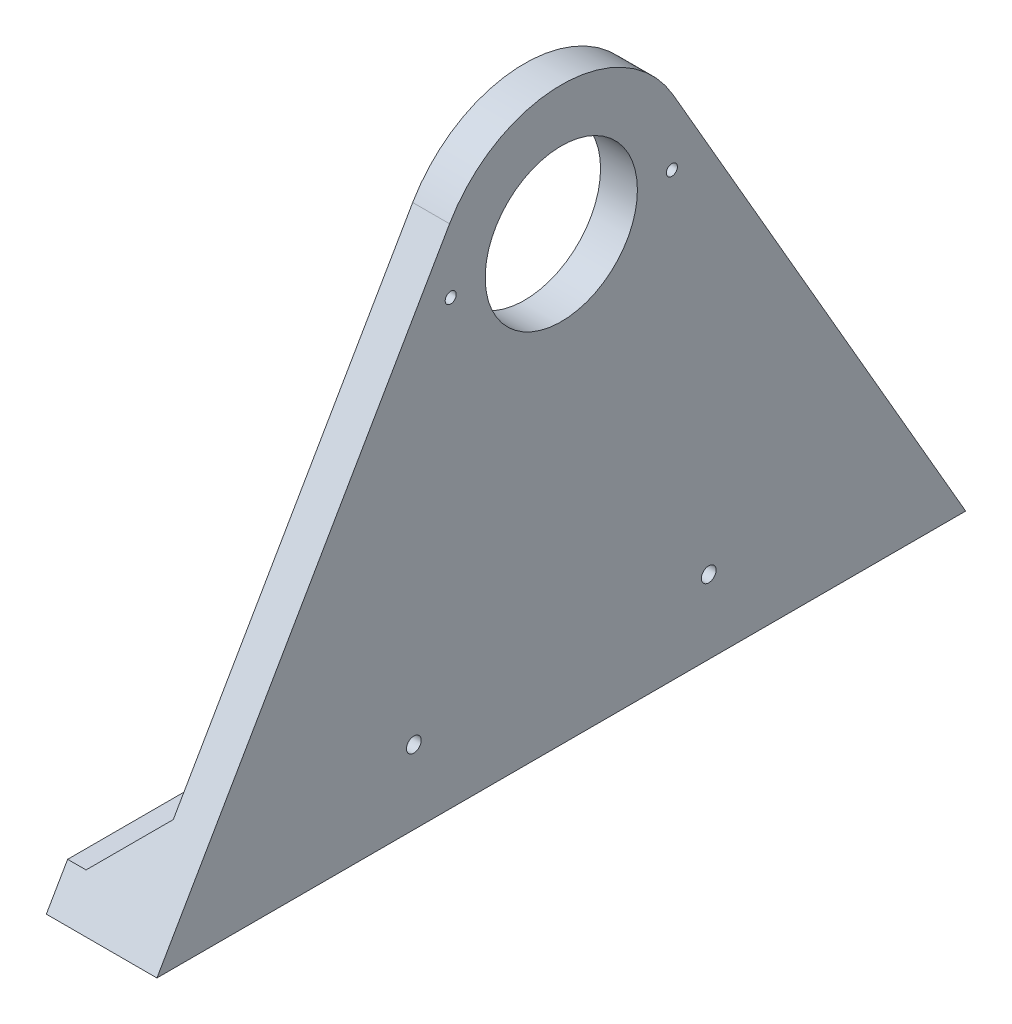
from build123d import *

# Parameters (mm, degrees)
CROQUIS1_R              = 20.65
CROQUIS1_R_2            = 1.5
SALIENTE_EXTRUIR1_DEPTH = 5
SALIENTE_EXTRUIR2_DEPTH = 20
CROQUIS3_R              = 1.5
CORTAR_EXTRUIR1_DEPTH   = 20
CROQUIS4_R              = 2
CORTAR_EXTRUIR2_DEPTH   = 166.327956902
CHAFL_N1_SIZE           = 15
CROQUIS5_R              = 7
CROQUIS5_R_2            = 2
CORTAR_EXTRUIR3_DEPTH   = 30
CORTAR_EXTRUIR4_START   = 30
CROQUIS6_R              = 6.5
CROQUIS6_R_2            = 1.5
CORTAR_EXTRUIR4_DEPTH   = 30


with BuildPart() as part:
    # Croquis1 → Saliente-Extruir1 (new, symmetric)
    with BuildSketch(Plane(origin=(0, 0, 0), x_dir=(0, 0, -1), z_dir=(1, 0, 0))):
        with BuildLine():
            Line((-109.696551146, -120), (109.696551146, -120))
            Line((109.696551146, -120), (30.310889132, 17.5))
            ThreePointArc((30.310889132, 17.5), (0, 35), (-30.310889132, 17.5))
            Line((-30.310889132, 17.5), (-109.696551146, -120))
        make_face()
        Circle(CROQUIS1_R, mode=Mode.SUBTRACT)
        with Locations((-30, 0)):
            Circle(CROQUIS1_R_2, mode=Mode.SUBTRACT)
        with Locations((30, 0)):
            Circle(CROQUIS1_R_2, mode=Mode.SUBTRACT)
    extrude(amount=SALIENTE_EXTRUIR1_DEPTH, both=True)

    # Croquis2 → Saliente-Extruir2 (add)
    with BuildSketch(Plane.ZY.offset(5)):
        Polygon((-109.696551146, -120), (-103.923048454, -110), (103.923048454, -110), (109.696551146, -120), align=None)
    extrude(amount=SALIENTE_EXTRUIR2_DEPTH)

    # Croquis3 → Cortar-Extruir1 (cut)
    with BuildSketch(Plane(origin=(0, -110, 0), x_dir=(1, 0, 0), z_dir=(0, 1, 0))):
        with Locations(Location((-15, 60, 0), (0, 0, 270))):
            Circle(CROQUIS3_R)
        with Locations(Location((-15, -60, 0), (0, 0, 270))):
            Circle(CROQUIS3_R)
        with Locations(Location((-15, 0, 0), (0, 0, 270))):
            Circle(CROQUIS3_R)
    extrude(amount=-CORTAR_EXTRUIR1_DEPTH, mode=Mode.SUBTRACT)

    # Croquis4 → Cortar-Extruir2 (cut, through all)
    with BuildSketch(Plane(origin=(5, 0, 0), x_dir=(0, 0, -1), z_dir=(1, 0, 0))):
        with Locations((-40, -100)):
            Circle(CROQUIS4_R)
        with Locations((40, -100)):
            Circle(CROQUIS4_R)
    extrude(amount=-CORTAR_EXTRUIR2_DEPTH, mode=Mode.SUBTRACT)

    # Chaflán1
    # the kernel refuses this chamfer: 15 mm, written as the material it adds along each edge
    with BuildSketch(Plane(origin=(-5, -110, -142.498293274), x_dir=(0.02749587661058636, 0.9996219169112966, 0), z_dir=(0, 0, 1))) as chafl_n1_piece_1_section:
        Polygon((CHAFL_N1_SIZE * 0.999621916911, CHAFL_N1_SIZE * 0.0274958766106), (-CHAFL_N1_SIZE * 0.0274958766106, CHAFL_N1_SIZE * 0.999621916911), (0, 0), align=None)
    chafl_n1_piece_1 = extrude(amount=284.996586547, mode=Mode.PRIVATE)
    chafl_n1_piece_1 = split(chafl_n1_piece_1, bisect_by=Plane(origin=(-9.982063802, -61.362690363, 75.842284643), z_dir=(0, -0.500000000000004, -0.8660254037844364)), keep=Keep.TOP, mode=Mode.PRIVATE)
    chafl_n1_piece_1 = split(chafl_n1_piece_1, bisect_by=Plane(origin=(-9.982063802, -61.362690271, -75.84228459), z_dir=(0, -0.4999999999999981, 0.8660254037844397)), keep=Keep.TOP, mode=Mode.PRIVATE)
    chafl_n1_piece_1 = chafl_n1_piece_1 - Plane(origin=(-9.982063802, -100, 40), x_dir=(0, 0, -1), z_dir=(1, 0, 0)) * Cylinder(2, 630, mode=Mode.PRIVATE)
    chafl_n1_piece_1 = chafl_n1_piece_1 - Plane(origin=(-9.982063802, -100, -40), x_dir=(0, 0, -1), z_dir=(1, 0, 0)) * Cylinder(2, 630, mode=Mode.PRIVATE)
    chafl_n1_piece_1 = chafl_n1_piece_1 - Plane(origin=(-15, -105.150253756, -60), x_dir=(0, 0, 1), z_dir=(0, 1, 0)) * Cylinder(1.5, 630, mode=Mode.PRIVATE)
    chafl_n1_piece_1 = chafl_n1_piece_1 - Plane(origin=(-15, -105.150253756, 0), x_dir=(0, 0, 1), z_dir=(0, 1, 0)) * Cylinder(1.5, 630, mode=Mode.PRIVATE)
    chafl_n1_piece_1 = chafl_n1_piece_1 - Plane(origin=(-15, -105.150253756, 60), x_dir=(0, 0, 1), z_dir=(0, 1, 0)) * Cylinder(1.5, 630, mode=Mode.PRIVATE)
    add(chafl_n1_piece_1)

    # Croquis5 → Cortar-Extruir3 (cut)
    # profile 1 of 2: a face of its own
    with BuildSketch(Plane.ZY.offset(5)):
        with Locations((-40, -100)):
            Circle(CROQUIS5_R)
        with Locations(Location((-40, -100, 0), (0, 0, 180))):
            Circle(CROQUIS5_R_2, mode=Mode.SUBTRACT)
    # profile 2 of 2: a face of its own
    with BuildSketch(Plane.ZY.offset(5)):
        with Locations((40, -100)):
            Circle(CROQUIS5_R)
        with Locations(Location((40, -100, 0), (0, 0, 180))):
            Circle(CROQUIS5_R_2, mode=Mode.SUBTRACT)
    extrude(amount=CORTAR_EXTRUIR3_DEPTH, mode=Mode.SUBTRACT)

    # Croquis6 → Cortar-Extruir4 (cut)
    # profile 1 of 3: a face of its own
    with BuildSketch(Plane(origin=(0, -110, 0), x_dir=(1, 0, 0), z_dir=(0, 1, 0)).offset(CORTAR_EXTRUIR4_START)):
        with Locations((-15, 60)):
            Circle(CROQUIS6_R)
        with Locations(Location((-15, 60, 0), (0, 0, 270))):
            Circle(CROQUIS6_R_2, mode=Mode.SUBTRACT)
    # profile 2 of 3: a face of its own
    with BuildSketch(Plane(origin=(0, -110, 0), x_dir=(1, 0, 0), z_dir=(0, 1, 0)).offset(CORTAR_EXTRUIR4_START)):
        with Locations((-15, 0)):
            Circle(CROQUIS6_R)
        with Locations(Location((-15, 0, 0), (0, 0, 270))):
            Circle(CROQUIS6_R_2, mode=Mode.SUBTRACT)
    # profile 3 of 3: a face of its own
    with BuildSketch(Plane(origin=(0, -110, 0), x_dir=(1, 0, 0), z_dir=(0, 1, 0)).offset(CORTAR_EXTRUIR4_START)):
        with Locations((-15, -60)):
            Circle(CROQUIS6_R)
        with Locations(Location((-15, -60, 0), (0, 0, 270))):
            Circle(CROQUIS6_R_2, mode=Mode.SUBTRACT)
    extrude(amount=-CORTAR_EXTRUIR4_DEPTH, mode=Mode.SUBTRACT)


solid = part.part
